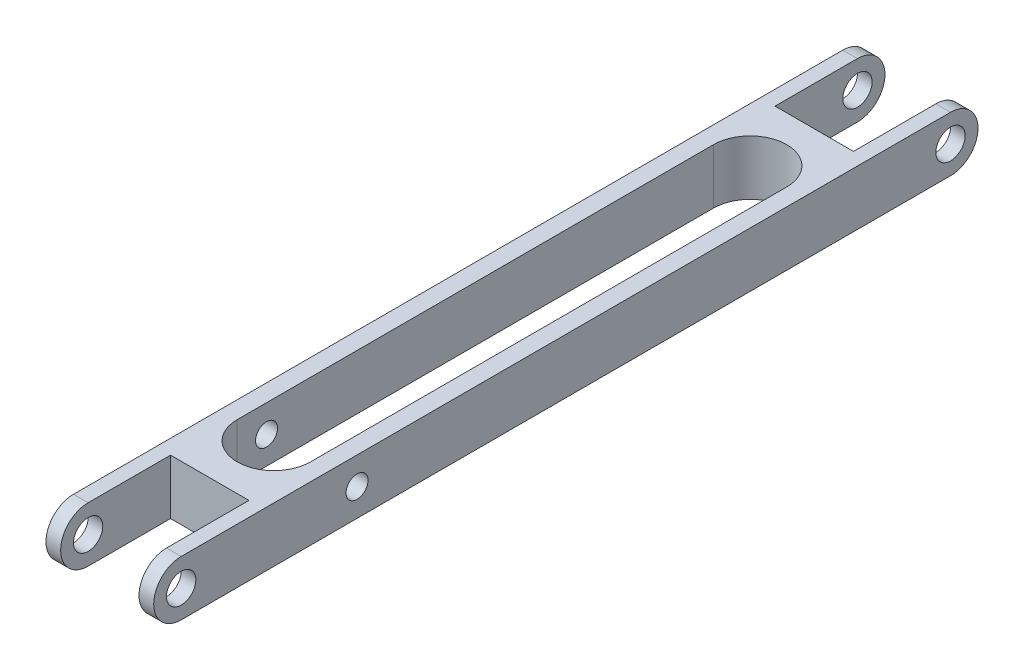
from build123d import *

# Parameters (mm, degrees)
EXTRUDE_1_DEPTH     = 29.4
SKETCH_3_W          = 21.4
SKETCH_3_H          = 30
CUT_EXTRUDE_1_DEPTH = 118.241673478
SKETCH_4_R          = 4
CUT_EXTRUDE_2_DEPTH = 117.519783728
CUT_EXTRUDE_3_DEPTH = 118.241673478
SKETCH_6_R          = 3
CUT_EXTRUDE_4_DEPTH = 117.519783728


with BuildPart() as part:
    # 草图2 → 凸台-拉伸1 (new body)
    with BuildSketch(Plane(origin=(0, 0, 0), x_dir=(0, 0, -1), z_dir=(1, 0, 0))):
        with BuildLine():
            Line((-105, -7.5), (105, -7.5))
            ThreePointArc((105, -7.5), (112.5, 0), (105, 7.5))
            Line((105, 7.5), (-105, 7.5))
            ThreePointArc((-105, 7.5), (-112.5, 0), (-105, -7.5))
        make_face()
    extrude(amount=EXTRUDE_1_DEPTH)

    # 草图3 → 切除-拉伸1 (cut, through all)
    with BuildSketch(Plane(origin=(0, 7.5, 0), x_dir=(1, 0, 0), z_dir=(0, 1, 0))):
        with Locations((14.7, -97.5)):
            Rectangle(SKETCH_3_W, SKETCH_3_H)
        with Locations((14.7, 97.5)):
            Rectangle(SKETCH_3_W, SKETCH_3_H)
    extrude(amount=-CUT_EXTRUDE_1_DEPTH, mode=Mode.SUBTRACT)

    # 草图4 → 切除-拉伸2 (cut, through all)
    with BuildSketch(Plane(origin=(29.4, 0, 0), x_dir=(0, 0, -1), z_dir=(1, 0, 0))):
        with Locations((-105, 0)):
            Circle(SKETCH_4_R)
        with Locations((105, 0)):
            Circle(SKETCH_4_R)
    extrude(amount=-CUT_EXTRUDE_2_DEPTH, mode=Mode.SUBTRACT)

    # 草图5 → 切除-拉伸3 (cut, through all)
    with BuildSketch(Plane.XZ.offset(7.5)):
        with BuildLine():
            Line((24.7, 65), (24.7, -65))
            ThreePointArc((24.7, -65), (14.7, -75), (4.7, -65))
            Line((4.7, -65), (4.7, 65))
            ThreePointArc((4.7, 65), (14.7, 75), (24.7, 65))
        make_face()
    extrude(amount=-CUT_EXTRUDE_3_DEPTH, mode=Mode.SUBTRACT)

    # 草图6 → 切除-拉伸4 (cut, through all)
    with BuildSketch(Plane.ZY):
        with Locations((57, 0)):
            Circle(SKETCH_6_R)
    extrude(amount=-CUT_EXTRUDE_4_DEPTH, mode=Mode.SUBTRACT)


solid = part.part
